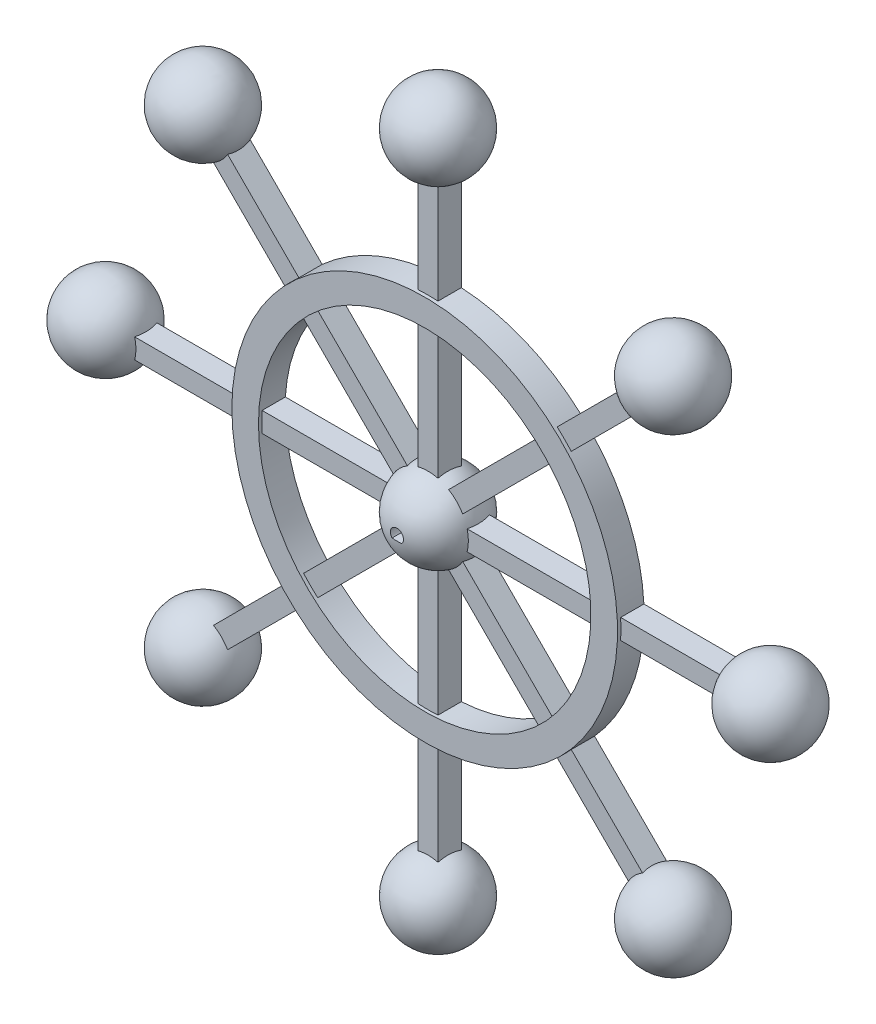
from build123d import *

# Parameters (mm, degrees)
BOSS_EXTRUDE1_START     = -5.08
SKETCH2_W               = 127
SKETCH2_H               = 7.62
BOSS_EXTRUDE1_DEPTH     = 8.89
CIRPATTERN1_COUNT       = 8
SKETCH5_R               = 73.66
SKETCH5_R_2             = 63.5
BOSS_EXTRUDE2_DEPTH     = 10.16
CUT_EXTRUDE1_DEPTH      = 181.823427755
CUT_EXTRUDE1_DEPTH_BACK = 181.823427755
CIRPATTERN2_COUNT       = 8


with BuildPart() as part:
    # Sketch1 → Revolve1 (revolve)
    with BuildSketch(Plane.XY):
        with BuildLine():
            Line((0, 15.875), (0, -15.875))
            ThreePointArc((0, -15.875), (15.875, 0), (0, 15.875))
        make_face()
    revolve(axis=Axis((0, 15.875, 0), (0, -1, 0)))

    # Sketch2 → Boss-Extrude1 (add)
    with BuildSketch(Plane.XY.offset(BOSS_EXTRUDE1_START)):
        with Locations((63.5, 0)):
            Rectangle(SKETCH2_W, SKETCH2_H)
    boss_extrude1 = extrude(amount=BOSS_EXTRUDE1_DEPTH)

    # CirPattern1: Boss-Extrude1 ×8 about axis
    cirpattern1_axis = Axis((0, 0, 0), (0, 0, -1))
    for i in range(1, CIRPATTERN1_COUNT):
        add(boss_extrude1.rotate(cirpattern1_axis, i * 360 / CIRPATTERN1_COUNT))

    # Sketch5 → Boss-Extrude2 (add)
    with BuildSketch(Plane(origin=(0, 0, -5.08), x_dir=(-1, 0, 0), z_dir=(0, 0, -1))):
        Circle(SKETCH5_R)
        Circle(SKETCH5_R_2, mode=Mode.SUBTRACT)
    extrude(amount=-BOSS_EXTRUDE2_DEPTH)

    # Sketch6 → Cut-Extrude1 (cut, two sides: drawn at the far end of the back side and taken through both)
    with BuildSketch(Plane(origin=(0, 0, -5.08), x_dir=(-1, 0, 0), z_dir=(0, 0, -1)).offset(-CUT_EXTRUDE1_DEPTH_BACK)):
        with BuildLine():
            Line((-1.855488288, -1.67829283), (1.855488288, -1.67829283))
            ThreePointArc((1.855488288, -1.67829283), (0, 2.5019), (-1.855488288, -1.67829283))
        make_face()
    extrude(amount=CUT_EXTRUDE1_DEPTH + CUT_EXTRUDE1_DEPTH_BACK, mode=Mode.SUBTRACT)

    # Sketch7 → Revolve2 (revolve)
    with BuildSketch(Plane.XY):
        with BuildLine():
            Line((0, 111.125), (0, 142.875))
            ThreePointArc((0, 142.875), (15.875, 127), (0, 111.125))
        make_face()
    revolve2 = revolve(axis=Axis((0, 111.125, 0), (0, 1, 0)))

    # CirPattern2: Revolve2 ×8 about axis
    cirpattern2_axis = Axis((0, 0, 0), (0, 0, -1))
    for i in range(1, CIRPATTERN2_COUNT):
        add(revolve2.rotate(cirpattern2_axis, i * 360 / CIRPATTERN2_COUNT))


solid = part.part
